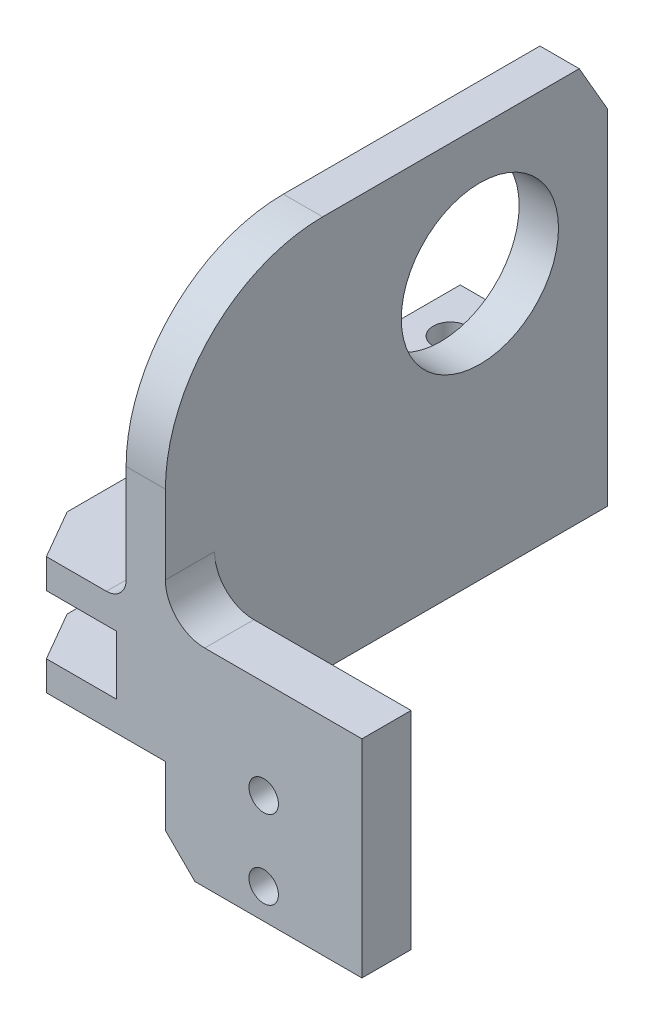
from build123d import *

# Parameters (mm, degrees)
ESTRUSIONE_ESTRUSIONE1_DEPTH = 45
SCHIZZO2_W                   = 5
SCHIZZO2_H                   = 21.077960569
ESTRUSIONE_ESTRUSIONE2_DEPTH = 20
SCHIZZO3_W                   = 4
SCHIZZO3_H                   = 45
ESTRUSIONE_ESTRUSIONE3_DEPTH = 28
SCHIZZO4_R                   = 8
TAGLIO_ESTRUSIONE1_DEPTH     = 28
SMUSSO1_SIZE                 = 5
SMUSSO1_SIZE2                = 2.886751346
SCHIZZO5_R                   = 1.75
TAGLIO_ESTRUSIONE2_DEPTH     = 28
RACCORDO1_R                  = 2
SMUSSO3_SIZE                 = 5
SMUSSO3_SIZE2                = 2.886751346
SMUSSO4_SIZE                 = 5
SMUSSO4_SIZE2                = 2.886751346
SCHIZZO7_R                   = 1.5
TAGLIO_ESTRUSIONE3_DEPTH     = 28
SMUSSO5_SIZE                 = 3
RACCORDO3_R                  = 4
RACCORDO4_R                  = 16


with BuildPart() as part:
    # Schizzo1 → Estrusione-Estrusione1 (new body)
    with BuildSketch(Plane.XY):
        Polygon((0, 0), (10, 0), (10, -6), (0, -6), (0, -9), (15, -9), (15, 3), (0, 3), align=None)
    extrude(amount=ESTRUSIONE_ESTRUSIONE1_DEPTH)

    # Schizzo2 → Estrusione-Estrusione2 (add)
    with BuildSketch(Plane(origin=(15, 0, 0), x_dir=(0, 0, -1), z_dir=(1, 0, 0))):
        with Locations((-42.5, -7.538980285)):
            Rectangle(SCHIZZO2_W, SCHIZZO2_H)
    extrude(amount=ESTRUSIONE_ESTRUSIONE2_DEPTH)

    # Schizzo3 → Estrusione-Estrusione3 (add)
    with BuildSketch(Plane(origin=(0, 3, 0), x_dir=(1, 0, 0), z_dir=(0, 1, 0))):
        with Locations((13, -22.5)):
            Rectangle(SCHIZZO3_W, SCHIZZO3_H)
    extrude(amount=ESTRUSIONE_ESTRUSIONE3_DEPTH)

    # Schizzo4 → Taglio-Estrusione1 (cut)
    with BuildSketch(Plane.ZY.offset(-11)):
        with Locations((13, 18)):
            Circle(SCHIZZO4_R)
    extrude(amount=-TAGLIO_ESTRUSIONE1_DEPTH, mode=Mode.SUBTRACT)

    # Smusso1
    smusso1_edges = [part.edges().sort_by_distance(p)[0] for p in [
        (13, 31, 0),
    ]]
    smusso1_side = [part.faces().sort_by_distance(p)[0] for p in [
        (5, 0.427200187, 0),
    ]]
    chamfer(smusso1_edges, length=SMUSSO1_SIZE, length2=SMUSSO1_SIZE2, reference=smusso1_side[0])

    # Schizzo5 → Taglio-Estrusione2 (cut)
    with BuildSketch(Plane(origin=(0, 3, 0), x_dir=(1, 0, 0), z_dir=(0, 1, 0))):
        with Locations((4, -5)):
            Circle(SCHIZZO5_R)
        with Locations((4, -25)):
            Circle(SCHIZZO5_R)
    extrude(amount=-TAGLIO_ESTRUSIONE2_DEPTH, mode=Mode.SUBTRACT)

    # Raccordo1
    raccordo1_edges = [part.edges().sort_by_distance(p)[0] for p in [
        (11, 3, 22.5),
    ]]
    fillet(raccordo1_edges, radius=RACCORDO1_R)

    # Smusso3
    smusso3_edges = [part.edges().sort_by_distance(p)[0] for p in [
        (0, 1.5, 45),
    ]]
    smusso3_side = [part.faces().sort_by_distance(p)[0] for p in [
        (0, 1.5, 22.5),
    ]]
    chamfer(smusso3_edges, length=SMUSSO3_SIZE, length2=SMUSSO3_SIZE2, reference=smusso3_side[0])

    # Smusso4
    smusso4_edges = [part.edges().sort_by_distance(p)[0] for p in [
        (0, -7.5, 45),
    ]]
    smusso4_side = [part.faces().sort_by_distance(p)[0] for p in [
        (0, -7.5, 22.5),
    ]]
    chamfer(smusso4_edges, length=SMUSSO4_SIZE, length2=SMUSSO4_SIZE2, reference=smusso4_side[0])

    # Schizzo7 → Taglio-Estrusione3 (cut)
    with BuildSketch(Plane.XY.offset(45)):
        with Locations((25, -7)):
            Circle(SCHIZZO7_R)
        with Locations((25, -15)):
            Circle(SCHIZZO7_R)
    extrude(amount=-TAGLIO_ESTRUSIONE3_DEPTH, mode=Mode.SUBTRACT)

    # Smusso5
    smusso5_edges = [part.edges().sort_by_distance(p)[0] for p in [
        (15, -18.077960569, 42.5),
    ]]
    chamfer(smusso5_edges, length=SMUSSO5_SIZE)

    # Raccordo3
    raccordo3_edges = [part.edges().sort_by_distance(p)[0] for p in [
        (15, 3, 42.5),
    ]]
    fillet(raccordo3_edges, radius=RACCORDO3_R)

    # Raccordo4
    raccordo4_edges = [part.edges().sort_by_distance(p)[0] for p in [
        (13, 31, 45),
    ]]
    fillet(raccordo4_edges, radius=RACCORDO4_R)


solid = part.part
